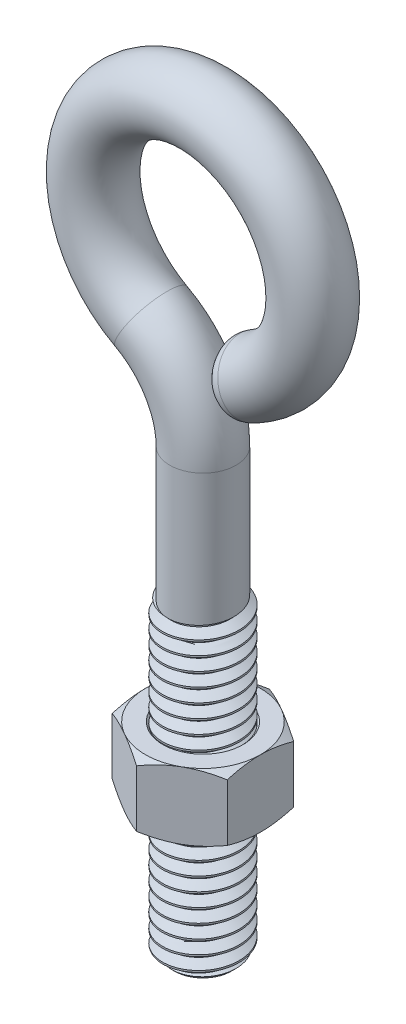
from build123d import *

# Parameters (mm, degrees)
BOSS_EXTRUDE1_START = -32.8295
SKETCH2_R           = 3.96875
BOSS_EXTRUDE1_DEPTH = 31.75
SKETCH7_R           = 3.429
FILLET1_R           = 1.984375
CHAMFER1_SIZE       = 1.031875
BOSS_EXTRUDE2_START = -13.97
SKETCH9_R           = 3.96875
BOSS_EXTRUDE2_DEPTH = 6.9453125
CUT_SWEEP1_PITCH    = 1.411111111


with BuildPart() as part:
    # Sketch2 → Boss-Extrude1 (new body)
    with BuildSketch(Plane(origin=(0, 0, 0), x_dir=(1, 0, 0), z_dir=(0, 1, 0)).offset(BOSS_EXTRUDE1_START)):
        with Locations(Location((0, 0, 0), (0, 0, 270))):
            Circle(SKETCH2_R)
    extrude(amount=-BOSS_EXTRUDE1_DEPTH)

    # Sweep1: sweep along a path in Sketch8
    with BuildLine(Plane.XY) as sweep1_path:
        Line((0, -32.8295), (0, -18.978003115))
        ThreePointArc((0, -18.978003115), (-1.443760926, -13.757583937), (-5.364719764, -10.020833503))
        ThreePointArc((-5.364719764, -10.020833503), (1.070835648, 11.315945973), (3.389767085, -10.849276536))
    # Sketch7 → Sweep1 (sweep)
    with BuildSketch(Plane(origin=(0, -32.8295, 0), x_dir=(1, 0, 0), z_dir=(0, 1, 0))):
        Circle(SKETCH7_R)
    sweep(path=sweep1_path.line)

    # Fillet1
    fillet1_edges = [part.edges().sort_by_distance(p)[0] for p in [
        (4.412378384, -14.122242642, 0),
    ]]
    fillet(fillet1_edges, radius=FILLET1_R)

    # Chamfer1
    chamfer1_edges = [part.edges().sort_by_distance(p)[0] for p in [
        (0, -64.5795, -3.96875),
    ]]
    chamfer(chamfer1_edges, length=CHAMFER1_SIZE)

    # Cut-Sweep1: the profile of Sketch4 screwed along a right-hand helix of 23.5 turns, 8 arcs to a turn; built about Z, then put on its axis
    cut_sweep1_z = Axis((0, 0, 0), (0, 0, 1))
    cut_sweep1_corners = [(4.045128629, 0, 0.044097222), (3.052206448, 0, -0.529166667), (3.052206448, 0, -0.705555556), (4.045128629, 0, -1.278819444)]
    with BuildLine(mode=Mode.PRIVATE) as cut_sweep1_profile:
        Line(cut_sweep1_corners[0], cut_sweep1_corners[1])
        Line(cut_sweep1_corners[1], cut_sweep1_corners[2])
        Line(cut_sweep1_corners[2], cut_sweep1_corners[3])
        Line(cut_sweep1_corners[3], cut_sweep1_corners[0])
    cut_sweep1_cap = Face(cut_sweep1_profile.wire())
    cut_sweep1_turn_angles = [0, 22.5, 45, 67.5, 90, 112.5, 135, 157.5, 180, 202.5, 225, 247.5, 270, 292.5, 315, 337.5, 360]
    cut_sweep1_turn_weights = [1, 0.9238795325112867, 1, 0.9238795325112867, 1, 0.9238795325112867, 1, 0.9238795325112867, 1, 0.9238795325112867, 1, 0.9238795325112867, 1, 0.9238795325112867, 1, 0.9238795325112867, 1]
    cut_sweep1_turn_rails = [Edge.make_bspline([Vector(p[0], p[1], 0).rotate(cut_sweep1_z, cut_sweep1_turn_angles[k]) / cut_sweep1_turn_weights[k] + Vector(0, 0, p[2] + CUT_SWEEP1_PITCH * cut_sweep1_turn_angles[k] / 360) for k in range(17)], [0, 0, 0, 1, 1, 2, 2, 3, 3, 4, 4, 5, 5, 6, 6, 7, 7, 8, 8, 8], 2, cut_sweep1_turn_weights) for p in cut_sweep1_corners]
    cut_sweep1_turn_sides = [Face.make_surface_from_curves(cut_sweep1_turn_rails[p[0]], cut_sweep1_turn_rails[p[1]]) for p in [(0, 1), (1, 2), (2, 3), (3, 0)]]
    cut_sweep1_last_angles = [8280, 8302.5, 8325, 8347.5, 8370, 8392.5, 8415, 8437.5, 8460]
    cut_sweep1_last_weights = [1, 0.9238795325112867, 1, 0.9238795325112867, 1, 0.9238795325112867, 1, 0.9238795325111531, 1]
    cut_sweep1_last_rails = [Edge.make_bspline([Vector(p[0], p[1], 0).rotate(cut_sweep1_z, cut_sweep1_last_angles[k]) / cut_sweep1_last_weights[k] + Vector(0, 0, p[2] + CUT_SWEEP1_PITCH * cut_sweep1_last_angles[k] / 360) for k in range(9)], [0, 0, 0, 1, 1, 2, 2, 3, 3, 4, 4, 4], 2, cut_sweep1_last_weights) for p in cut_sweep1_corners]
    cut_sweep1_last_sides = [Face.make_surface_from_curves(cut_sweep1_last_rails[p[0]], cut_sweep1_last_rails[p[1]]) for p in [(0, 1), (1, 2), (2, 3), (3, 0)]]
    cut_sweep1 = Plane(origin=(0, -64.5795, 0), x_dir=(1, 0, 0), z_dir=(0, 1, 0)) * Solid(Shell([*[p.moved(Location((0, 0, CUT_SWEEP1_PITCH * i))) for i in range(23) for p in cut_sweep1_turn_sides], *cut_sweep1_last_sides, cut_sweep1_cap, cut_sweep1_cap.rotate(cut_sweep1_z, 8460).moved(Location((0, 0, CUT_SWEEP1_PITCH * 8460 / 360)))]))
    add(cut_sweep1, mode=Mode.SUBTRACT)


with BuildPart() as body_2:
    # Sketch9 → Boss-Extrude2 (new body)
    with BuildSketch(Plane.XZ.offset(64.5795).offset(BOSS_EXTRUDE2_START)):
        Polygon((0, 6.874076643), (-5.953125, 3.437038321), (-5.953125, -3.437038321), (0, -6.874076643), (5.953125, -3.437038321), (5.953125, 3.437038321), align=None)
        with Locations(Location((0, 0, 0), (0, 0, 270))):
            Circle(SKETCH9_R, mode=Mode.SUBTRACT)
    extrude(amount=-BOSS_EXTRUDE2_DEPTH)

    # Sketch10 → Cut-Revolve1 (revolve, cut)
    with BuildSketch(Plane(origin=(0, 0, 0), x_dir=(0, 0, -1), z_dir=(1, 0, 0)), mode=Mode.PRIVATE) as cut_revolve1_sk:
        Polygon((-5.953125, -43.6641875), (-7.795028285, -43.6641875), (-7.795028285, -50.6095), (-5.953125, -50.6095), (-6.874076643, -50.077788321), (-6.874076643, -44.195899179), align=None)
        Polygon((-3.792361111, -43.6641875), (-3.792361111, -50.6095), (-4.145138889, -50.6095), (-3.96875, -50.433111111), (-3.96875, -43.840576389), (-4.145138889, -43.6641875), align=None)
    revolve(cut_revolve1_sk.sketch.rotate(Axis((0, -13.7795, 0), (0, -1, 0)), 90), axis=Axis((0, -13.7795, 0), (0, -1, 0)), mode=Mode.SUBTRACT)


solid = Compound([part.part, body_2.part])
